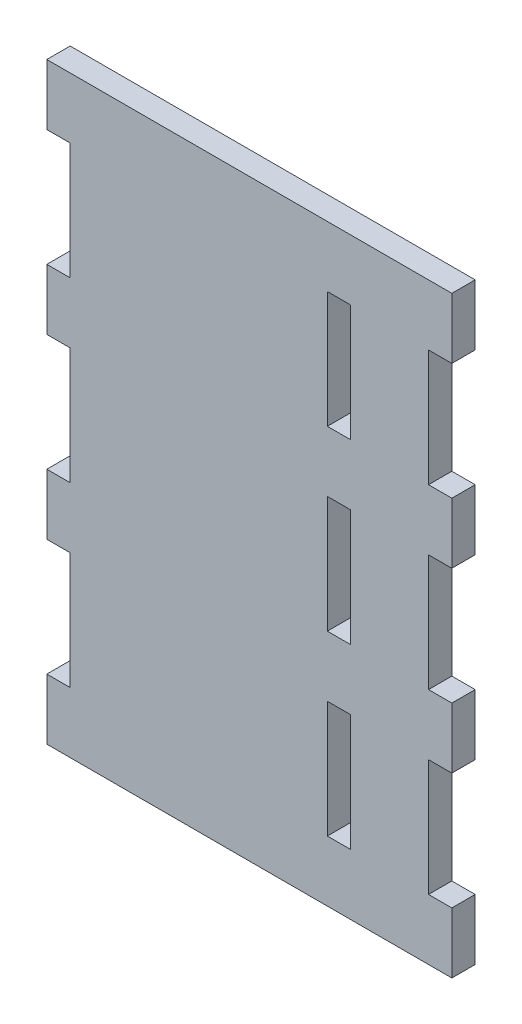
from build123d import *

# Parameters (mm, degrees)
SKETCH1_W           = 52.05
SKETCH1_H           = 76.2
BOSS_EXTRUDE1_DEPTH = 3
SKETCH2_W           = 3
SKETCH2_H           = 15
CUT_EXTRUDE1_DEPTH  = 73.446802019
LPATTERN1_COUNT     = 3
LPATTERN1_PITCH     = 22.8
SKETCH3_W           = 3
SKETCH3_H           = 15
CUT_EXTRUDE2_DEPTH  = 73.446802019
LPATTERN2_COUNT     = 3
LPATTERN2_PITCH     = 22.8


with BuildPart() as part:
    # Sketch1 → Boss-Extrude1 (new body)
    with BuildSketch(Plane.XY):
        with Locations((-14.968460648, -21.557986111)):
            Rectangle(SKETCH1_W, SKETCH1_H)
    extrude(amount=BOSS_EXTRUDE1_DEPTH)

    # Sketch2 → Cut-Extrude1 (cut, through all)
    with BuildSketch(Plane.XY.offset(3)):
        with Locations((-39.493460648, 1.242013889)):
            Rectangle(SKETCH2_W, SKETCH2_H)
        with Locations((9.556539352, 1.242013889)):
            Rectangle(SKETCH2_W, SKETCH2_H)
    cut_extrude1 = extrude(amount=-CUT_EXTRUDE1_DEPTH, mode=Mode.SUBTRACT)

    # LPattern1: Cut-Extrude1 ×3
    with Locations(*[(0, -i * LPATTERN1_PITCH, 0) for i in range(1, LPATTERN1_COUNT)]):
        add(cut_extrude1, mode=Mode.SUBTRACT)

    # Sketch3 → Cut-Extrude2 (cut, through all)
    with BuildSketch(Plane.XY.offset(3)):
        with Locations((-3.443460648, 1.242013889)):
            Rectangle(SKETCH3_W, SKETCH3_H)
    cut_extrude2 = extrude(amount=-CUT_EXTRUDE2_DEPTH, mode=Mode.SUBTRACT)

    # LPattern2: Cut-Extrude2 ×3
    with Locations(*[(0, -i * LPATTERN2_PITCH, 0) for i in range(1, LPATTERN2_COUNT)]):
        add(cut_extrude2, mode=Mode.SUBTRACT)


solid = part.part
